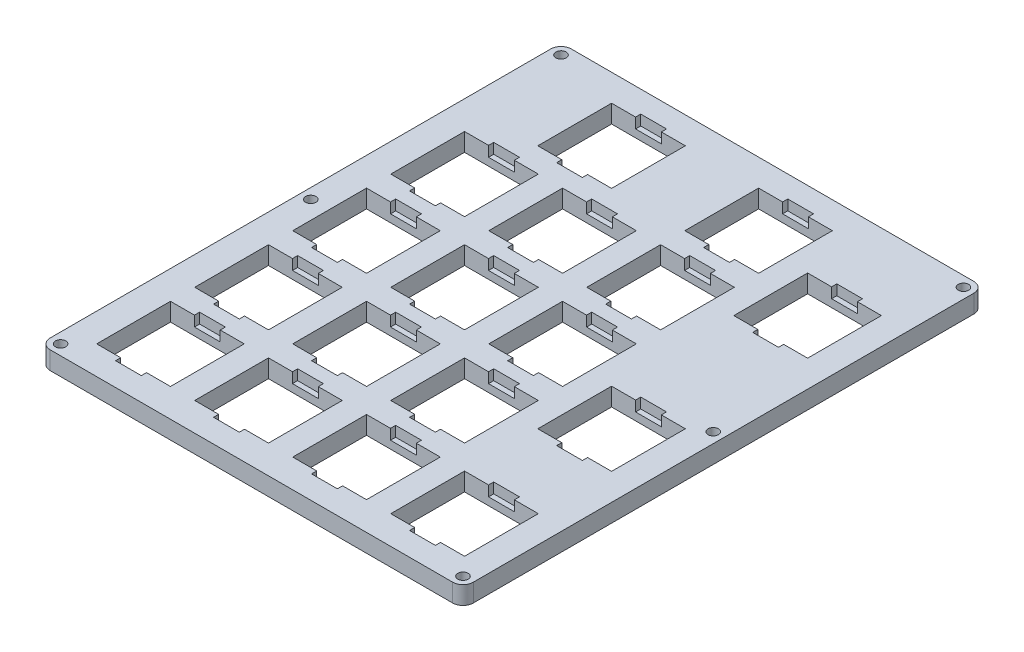
from build123d import *

# Parameters (mm, degrees)
ESQUISSE1_W                     = 76
ESQUISSE1_H                     = 95
BOSS_EXTRU_1_DEPTH              = 3.5
ESQUISSE2_W                     = 14.3
ESQUISSE2_H                     = 14.3
ENL_V_MAT_EXTRU_1_DEPTH         = 3.5
ENL_V_START                     = -1.5
ESQUISSE3_W                     = 5
ESQUISSE3_H                     = 2
ENL_V_MAT_EXTRU_2_DEPTH         = 2
R_P_TITION_LIN_AIRE1_COUNT      = 3
R_P_TITION_LIN_AIRE1_PITCH      = 19
R_P_TITION_LIN_AIRE1_COUNT_DIR2 = 4
R_P_TITION_LIN_AIRE1_PITCH_DIR2 = 19
R_P_TITION_LIN_AIRE2_COUNT      = 4
R_P_TITION_LIN_AIRE2_PITCH      = 19
ESQUISSE4_W                     = 14.3
ESQUISSE4_H                     = 14.3
ENL_V_MAT_EXTRU_3_DEPTH         = 3.5
ESQUISSE5_W                     = 5
ESQUISSE5_H                     = 2
ENL_V_MAT_EXTRU_4_DEPTH         = 2
ESQUISSE6_W                     = 82
ESQUISSE6_H                     = 101
ESQUISSE6_W_2                   = 76
ESQUISSE6_H_2                   = 95
BOSS_EXTRU_2_DEPTH              = 3.5
CONG_1_R                        = 2
ESQUISSE7_R                     = 1
ENL_V_MAT_EXTRU_5_DEPTH         = 3.5
CHANFREIN2_SIZE                 = 1


with BuildPart() as part:
    # Esquisse1 → Boss.-Extru.1 (new body)
    with BuildSketch(Plane(origin=(0, 0, 0), x_dir=(1, 0, 0), z_dir=(0, 1, 0))):
        Rectangle(ESQUISSE1_W, ESQUISSE1_H)
    extrude(amount=BOSS_EXTRU_1_DEPTH)

    # Esquisse2 → Enlèv. mat.-Extru.1 (cut)
    with BuildSketch(Plane.XZ):
        with Locations((-28.35, 37.85)):
            Rectangle(ESQUISSE2_W, ESQUISSE2_H)
    enl_v_mat_extru_1 = extrude(amount=-ENL_V_MAT_EXTRU_1_DEPTH, mode=Mode.SUBTRACT)

    # Esquisse3 → Enlèv. mat.-Extru.2 (cut)
    with BuildSketch(Plane.XZ.offset(ENL_V_START)):
        with Locations((-28.35, 45)):
            Rectangle(ESQUISSE3_W, ESQUISSE3_H)
        with Locations((-28.35, 30.7)):
            Rectangle(ESQUISSE3_W, ESQUISSE3_H)
    enl_v_mat_extru_2 = extrude(amount=-ENL_V_MAT_EXTRU_2_DEPTH, mode=Mode.SUBTRACT)

    # Répétition linéaire1: Enlèv. mat.-Extru.1, Enl_v. mat.-Extru.2 3 × 4
    with Locations(*[(i * R_P_TITION_LIN_AIRE1_PITCH, 0, -j * R_P_TITION_LIN_AIRE1_PITCH_DIR2) for i in range(R_P_TITION_LIN_AIRE1_COUNT) for j in range(R_P_TITION_LIN_AIRE1_COUNT_DIR2) if (i, j) != (0, 0)]):
        add(enl_v_mat_extru_1, mode=Mode.SUBTRACT)
        add(enl_v_mat_extru_2, mode=Mode.SUBTRACT)

    # Répétition linéaire2: Enlèv. mat.-Extru.1, Enlèv. mat.-Extru.2 ×4
    with Locations(*[(i * R_P_TITION_LIN_AIRE2_PITCH, 0, 0) for i in range(1, R_P_TITION_LIN_AIRE2_COUNT)]):
        add(enl_v_mat_extru_1, mode=Mode.SUBTRACT)
        add(enl_v_mat_extru_2, mode=Mode.SUBTRACT)

    # Esquisse4 → Enlèv. mat.-Extru.3 (cut)
    with BuildSketch(Plane.XZ):
        with Locations((9.65, -38.15)):
            Rectangle(ESQUISSE4_W, ESQUISSE4_H)
        with Locations((-18.85, -38.15)):
            Rectangle(ESQUISSE4_W, ESQUISSE4_H)
        with Locations((28.65, -28.65)):
            Rectangle(ESQUISSE4_W, ESQUISSE4_H)
        with Locations((28.65, 9.35)):
            Rectangle(ESQUISSE4_W, ESQUISSE4_H)
    extrude(amount=-ENL_V_MAT_EXTRU_3_DEPTH, mode=Mode.SUBTRACT)

    # Esquisse5 → Enlèv. mat.-Extru.4 (cut)
    with BuildSketch(Plane.XZ.offset(ENL_V_START)):
        with Locations((28.65, 16.5)):
            Rectangle(ESQUISSE5_W, ESQUISSE5_H)
        with Locations((28.65, 2.2)):
            Rectangle(ESQUISSE5_W, ESQUISSE5_H)
        with Locations((28.65, -21.5)):
            Rectangle(ESQUISSE5_W, ESQUISSE5_H)
        with Locations((28.65, -35.8)):
            Rectangle(ESQUISSE5_W, ESQUISSE5_H)
        with Locations((9.65, -31)):
            Rectangle(ESQUISSE5_W, ESQUISSE5_H)
        with Locations((9.65, -45.3)):
            Rectangle(ESQUISSE5_W, ESQUISSE5_H)
        with Locations((-18.85, -31)):
            Rectangle(ESQUISSE5_W, ESQUISSE5_H)
        with Locations((-18.85, -45.3)):
            Rectangle(ESQUISSE5_W, ESQUISSE5_H)
    extrude(amount=-ENL_V_MAT_EXTRU_4_DEPTH, mode=Mode.SUBTRACT)

    # Esquisse6 → Boss.-Extru.2 (add)
    with BuildSketch(Plane(origin=(0, 3.5, 0), x_dir=(1, 0, 0), z_dir=(0, 1, 0))):
        Rectangle(ESQUISSE6_W, ESQUISSE6_H)
        Rectangle(ESQUISSE6_W_2, ESQUISSE6_H_2, mode=Mode.SUBTRACT)
    extrude(amount=-BOSS_EXTRU_2_DEPTH)

    # Congé1
    cong_1_edges = [part.edges().sort_by_distance(p)[0] for p in [
        (-41, 1.75, -50.5),
        (41, 1.75, -50.5),
        (41, 1.75, 50.5),
        (-41, 1.75, 50.5),
    ]]
    fillet(cong_1_edges, radius=CONG_1_R)

    # Esquisse7 → Enlèv. mat.-Extru.5 (cut)
    with BuildSketch(Plane(origin=(0, 3.5, 0), x_dir=(1, 0, 0), z_dir=(0, 1, 0))):
        with Locations(Location((-39, 48.5, 0), (0, 0, 270))):
            Circle(ESQUISSE7_R)
        with Locations(Location((39, 48.5, 0), (0, 0, 270))):
            Circle(ESQUISSE7_R)
        with Locations(Location((-39, -48.5, 0), (0, 0, 270))):
            Circle(ESQUISSE7_R)
        with Locations(Location((39, -48.5, 0), (0, 0, 270))):
            Circle(ESQUISSE7_R)
        with Locations(Location((-39, 0, 0), (0, 0, 270))):
            Circle(ESQUISSE7_R)
        with Locations(Location((39, 0, 0), (0, 0, 270))):
            Circle(ESQUISSE7_R)
    extrude(amount=-ENL_V_MAT_EXTRU_5_DEPTH, mode=Mode.SUBTRACT)

    # Chanfrein2
    chanfrein2_edges = [part.edges().sort_by_distance(p)[0] for p in [
        (-39, 0, -1),
        (39, 0, 47.5),
        (-39, 0, 47.5),
        (39, 0, -49.5),
        (39, 0, -1),
        (-39, 0, -49.5),
    ]]
    chamfer(chanfrein2_edges, length=CHANFREIN2_SIZE - 0.0001)  # a hair under: the kernel refuses the full size


solid = part.part
